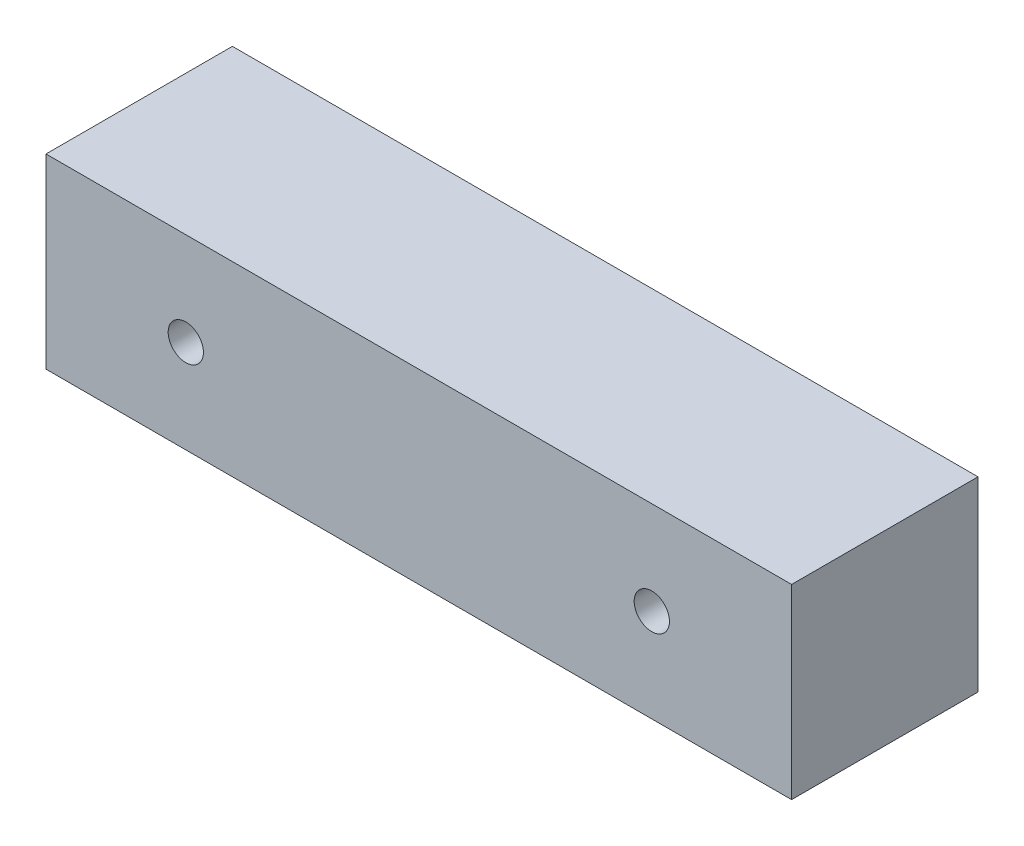
from build123d import *

# Parameters (mm, degrees)
CROQUIS1_W              = 80
CROQUIS1_H              = 20
CROQUIS1_R              = 1.892851096
SALIENTE_EXTRUIR1_DEPTH = 20


with BuildPart() as part:
    # Croquis1 → Saliente-Extruir1 (new body)
    with BuildSketch(Plane.XY):
        Rectangle(CROQUIS1_W, CROQUIS1_H)
        with Locations((25, 0)):
            Circle(CROQUIS1_R, mode=Mode.SUBTRACT)
        with Locations((-25, 0)):
            Circle(CROQUIS1_R, mode=Mode.SUBTRACT)
    extrude(amount=SALIENTE_EXTRUIR1_DEPTH)


solid = part.part
